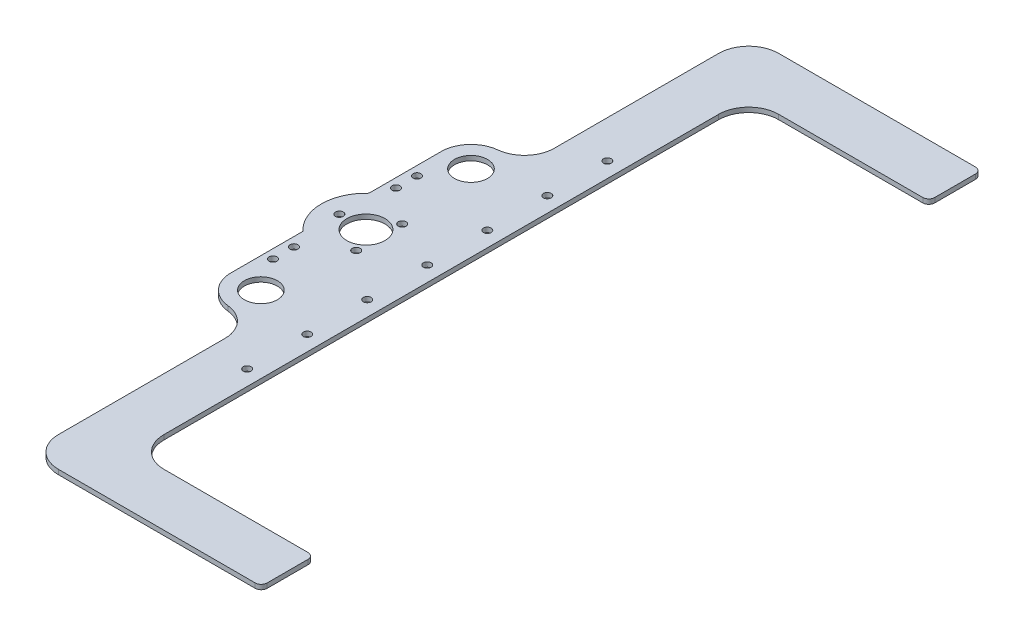
from build123d import *

# Parameters (mm, degrees)
SKETCH1_R           = 6.985
SKETCH1_R_2         = 1.6499967
SKETCH1_R_3         = 8.0645
BOSS_EXTRUDE1_DEPTH = 2
FILLET1_R           = 2.54


with BuildPart() as part:
    # Sketch1 → Boss-Extrude1 (new body)
    with BuildSketch(Plane(origin=(0, 0, 0), x_dir=(1, 0, 0), z_dir=(0, 1, 0))):
        with BuildLine():
            Line((-67.971311517, -52.728298572), (-67.971311517, -82.586411585))
            ThreePointArc((-67.971311517, -82.586411585), (-64.941959488, -91.499608698), (-56.608448003, -95.878494725))
            ThreePointArc((-56.608448003, -95.878494725), (-48.492989851, -100.008926653), (-45.228378476, -108.509717293))
            Line((-45.228378476, -108.509717293), (-45.228378476, -114.997272158))
            Line((-45.228378476, -114.997272158), (-45.228378476, -128.204620988))
            Line((-45.228378476, -128.204620988), (-45.228378476, -179.004620988))
            ThreePointArc((-45.228378476, -179.004620988), (-41.508634597, -187.984877109), (-32.528378476, -191.704620988))
            Line((-32.528378476, -191.704620988), (-22.903517531, -191.704620988))
            Line((-22.903517531, -191.704620988), (53.296482469, -191.704620988))
            Line((53.296482469, -191.704620988), (53.296482469, -169.379760042))
            Line((53.296482469, -169.379760042), (-10.203517531, -169.379760042))
            ThreePointArc((-10.203517531, -169.379760042), (-19.183773652, -165.660016163), (-22.903517531, -156.679760042))
            Line((-22.903517531, -156.679760042), (-22.903517531, -128.204620988))
            Line((-22.903517531, -128.204620988), (-22.903517531, 49.595379012))
            Line((-22.903517531, 49.595379012), (-22.903517531, 78.070518067))
            ThreePointArc((-22.903517531, 78.070518067), (-19.183773652, 87.050774188), (-10.203517531, 90.770518067))
            Line((-10.203517531, 90.770518067), (53.296482469, 90.770518067))
            Line((53.296482469, 90.770518067), (53.296482469, 113.095379012))
            Line((53.296482469, 113.095379012), (-22.903517531, 113.095379012))
            Line((-22.903517531, 113.095379012), (-32.528378476, 113.095379012))
            ThreePointArc((-32.528378476, 113.095379012), (-41.508634597, 109.375635133), (-45.228378476, 100.395379012))
            Line((-45.228378476, 100.395379012), (-45.228378476, 49.595379012))
            Line((-45.228378476, 49.595379012), (-45.228378476, 37.402727842))
            Line((-45.228378476, 37.402727842), (-45.228378476, 30.915172977))
            ThreePointArc((-45.228378476, 30.915172977), (-48.492989851, 22.414382337), (-56.608448003, 18.28395041))
            ThreePointArc((-56.608448003, 18.28395041), (-64.941959488, 13.905064383), (-67.971311517, 4.991867269))
            Line((-67.971311517, 4.991867269), (-67.971311517, -24.866245744))
            ThreePointArc((-67.971311517, -24.866245744), (-74.128017531, -38.797272158), (-67.971311517, -52.728298572))
        make_face()
        with Locations((-55.288517531, -83.247272158)):
            Circle(SKETCH1_R, mode=Mode.SUBTRACT)
        with Locations((-64.161311517, -69.277272158)):
            Circle(SKETCH1_R_2, mode=Mode.SUBTRACT)
        with Locations((-64.161311517, -60.387272158)):
            Circle(SKETCH1_R_2, mode=Mode.SUBTRACT)
        with Locations((-55.288517531, -38.797272158)):
            Circle(SKETCH1_R_3, mode=Mode.SUBTRACT)
        with Locations((-49.668767531, -29.063579632)):
            Circle(SKETCH1_R_2, mode=Mode.SUBTRACT)
        with Locations((-49.668767531, -48.530964684)):
            Circle(SKETCH1_R_2, mode=Mode.SUBTRACT)
        with Locations((-66.528017531, -38.797272158)):
            Circle(SKETCH1_R_2, mode=Mode.SUBTRACT)
        with Locations((-64.161311517, -17.207272158)):
            Circle(SKETCH1_R_2, mode=Mode.SUBTRACT)
        with Locations((-64.161311517, -8.317272158)):
            Circle(SKETCH1_R_2, mode=Mode.SUBTRACT)
        with Locations((-55.288517531, 5.652727842)):
            Circle(SKETCH1_R, mode=Mode.SUBTRACT)
        with Locations((-29.342032123, 37.402727842)):
            Circle(SKETCH1_R_2, mode=Mode.SUBTRACT)
        with Locations((-29.342032123, 12.002727842)):
            Circle(SKETCH1_R_2, mode=Mode.SUBTRACT)
        with Locations((-29.342032123, -13.397272158)):
            Circle(SKETCH1_R_2, mode=Mode.SUBTRACT)
        with Locations((-29.342032123, -38.797272158)):
            Circle(SKETCH1_R_2, mode=Mode.SUBTRACT)
        with Locations((-29.342032123, -64.197272158)):
            Circle(SKETCH1_R_2, mode=Mode.SUBTRACT)
        with Locations((-29.342032123, -89.597272158)):
            Circle(SKETCH1_R_2, mode=Mode.SUBTRACT)
        with Locations((-29.342032123, -114.997272158)):
            Circle(SKETCH1_R_2, mode=Mode.SUBTRACT)
    extrude(amount=BOSS_EXTRUDE1_DEPTH)

    # Fillet1
    fillet1_edges = [part.edges().sort_by_distance(p)[0] for p in [
        (53.296482469, 1, -113.095379012),
        (53.296482469, 1, -90.770518067),
        (53.296482469, 1, 169.379760042),
        (53.296482469, 1, 191.704620988),
    ]]
    fillet(fillet1_edges, radius=FILLET1_R)


solid = part.part
